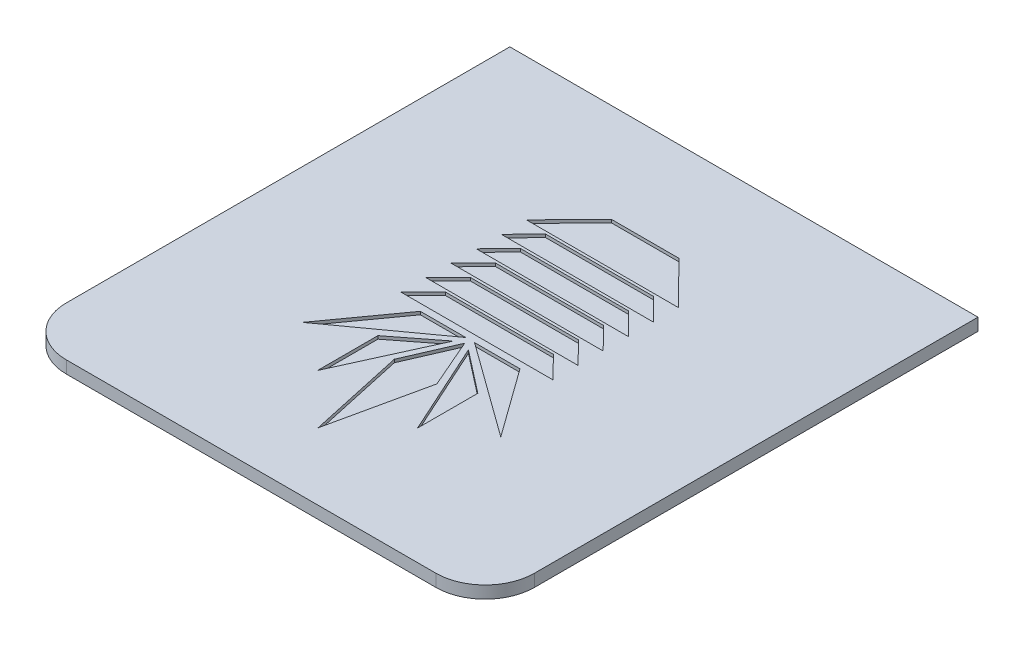
from build123d import *

# Parameters (mm, degrees)
SKETCH1_W           = 120.65
SKETCH1_H           = 127
BOSS_EXTRUDE1_DEPTH = 3.175
FILLET1_R           = 12.7
BOSS_EXTRUDE2_DEPTH = 6.35
CUT_EXTRUDE1_START  = -0.79375
CUT_EXTRUDE1_DEPTH  = 0.79375


# Read off the part's stored shape, not the designer's step: Cut-Extrude1
with BuildPart() as part:
    # Sketch1 → Boss-Extrude1 (new body)
    with BuildSketch(Plane(origin=(0, 0, 0), x_dir=(1, 0, 0), z_dir=(0, 1, 0))):
        Rectangle(SKETCH1_W, SKETCH1_H)
    extrude(amount=BOSS_EXTRUDE1_DEPTH)

    # Fillet1
    fillet1_edges = [part.edges().sort_by_distance(p)[0] for p in [
        (60.325, 1.5875, 63.5),
        (-60.325, 1.5875, 63.5),
    ]]
    fillet(fillet1_edges, radius=FILLET1_R)

    # Sketch2 → Boss-Extrude2 (add)
    with BuildSketch(Plane.XZ):
        with BuildLine():
            Line((-44.2595, -32.004), (-44.2595, -56.642))
            Line((-44.2595, -56.642), (44.2595, -56.642))
            Line((44.2595, -56.642), (44.2595, -32.004))
            ThreePointArc((44.2595, -32.004), (40.539756121, -23.023743879), (31.5595, -19.304))
            Line((31.5595, -19.304), (-31.5595, -19.304))
            ThreePointArc((-31.5595, -19.304), (-40.539756121, -23.023743879), (-44.2595, -32.004))
        make_face()
    extrude(amount=BOSS_EXTRUDE2_DEPTH)

    # Cut-Extrude1 outline → Cut-Extrude1 (cut)
    with BuildSketch(Plane(origin=(0, 3.175, 0), x_dir=(1, 0, 0), z_dir=(0, 1, 0)).offset(CUT_EXTRUDE1_START)):
        Polygon((19.586934791, 20.568683014), (13.900914294, 26.330878533), (-13.900917809, 26.330878533), (-19.586938306, 20.568683014), align=None)
        Polygon((25.558154067, -24.714180755), (12.840680417, -7.047287084), (1.136138921, -7.047287084), align=None)
        Polygon((-25.558126027, -24.714180755), (-1.13611088, -7.047287084), (-12.840652376, -7.047287084), align=None)
        Polygon((12.872252496, -17.941870118), (1.967957375, -9.461750192), (12.872252496, -33.488756649), align=None)
        Polygon((19.586934791, 14.109110528), (13.900914294, 19.871337603), (-13.900917809, 19.871337603), (-19.586938306, 14.109110528), align=None)
        Polygon((19.586934791, 7.649569598), (13.900882739, 13.411796673), (-13.900886254, 13.411796673), (-19.586938306, 7.649569598), align=None)
        Polygon((19.586934791, 1.190028667), (13.900914294, 6.952224187), (-13.900917809, 6.952224187), (-19.586938306, 1.190028667), align=None)
        Polygon((19.586934791, -5.269543818), (13.900914294, 0.492683256), (-13.900917809, 0.492683256), (-19.586938306, -5.269543818), align=None)
        Polygon((0, -8.460639301), (-5.496493939, -21.106287094), (0, -46.231527771), (5.496493939, -21.106287094), align=None)
        Polygon((-1.967957374, -9.461750193), (-12.872252495, -17.941870118), (-12.872252495, -33.488756649), align=None)
        Polygon((8.661555888, 38.1), (-8.661555888, 38.1), (-19.58692752, 27.028231496), (19.58692752, 27.028231496), align=None)
    extrude(amount=CUT_EXTRUDE1_DEPTH, mode=Mode.SUBTRACT)


solid = part.part
